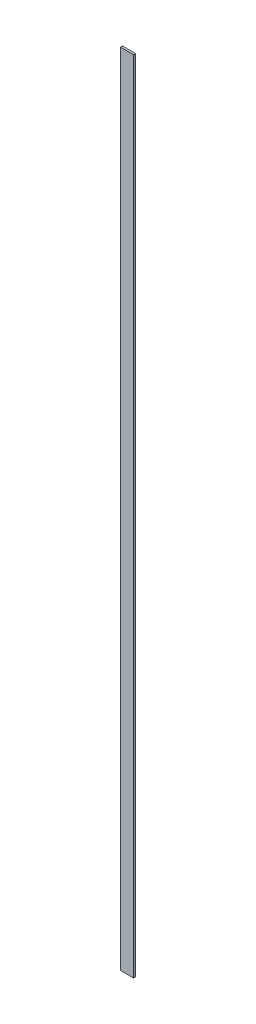
from build123d import *

# Parameters (mm, degrees)
SKETCH1_W           = 20
SKETCH1_H           = 1225
BOSS_EXTRUDE1_DEPTH = 3


with BuildPart() as part:
    # Sketch1 → Boss-Extrude1 (new body)
    with BuildSketch(Plane.XY.offset(-52.811189353)):
        with Locations((-304.293069475, 107.5)):
            Rectangle(SKETCH1_W, SKETCH1_H)
    extrude(amount=BOSS_EXTRUDE1_DEPTH)


solid = part.part
